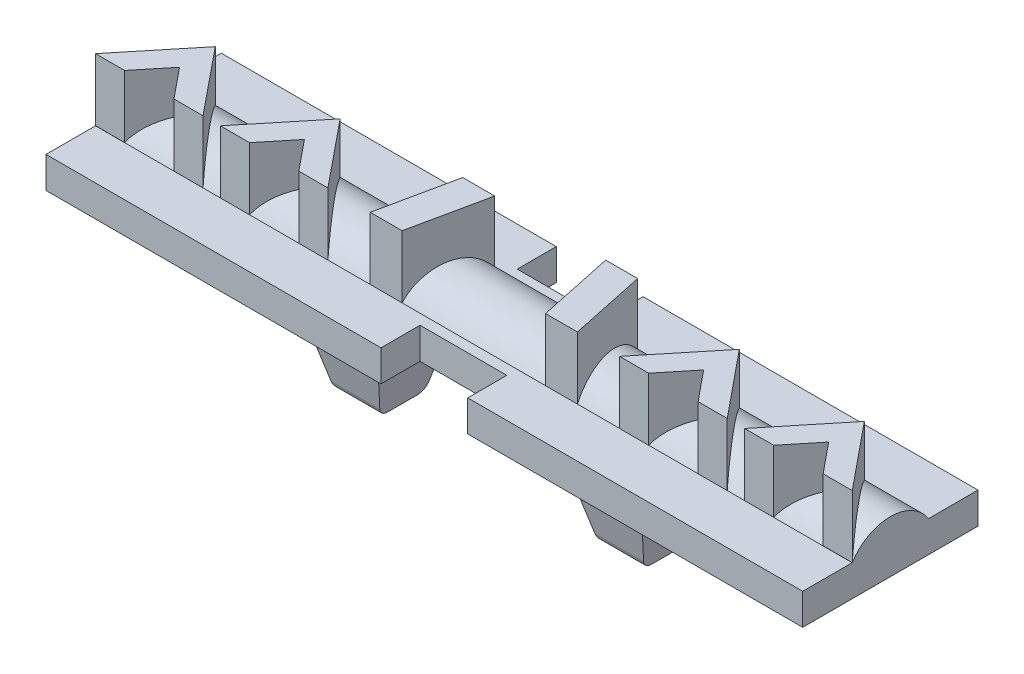
from build123d import *

# Parameters (mm, degrees)
EXTRUDE_1_DEPTH     = 109
EXTRUDE_2_DEPTH     = 18
SKETCH_3_W          = 25
SKETCH_3_H          = 11.25
CUT_EXTRUDE_1_DEPTH = 18
SKETCH_4_W          = 25
SKETCH_4_H          = 27
EXTRUDE_3_DEPTH     = 27
CUT_EXTRUDE_2_DEPTH = 122.166018853
CUT_EXTRUDE_3_DEPTH = 166.462013552
FILLET_1_R          = 3


# Read off the part's stored shape, not the designer's step: Бобышка-Вытянуть2
with BuildPart() as part:
    # Эскиз1 → Бобышка-Вытянуть1 (new, symmetric)
    with BuildSketch(Plane(origin=(0, 0, 0), x_dir=(0, 0, -1), z_dir=(1, 0, 0))):
        with BuildLine():
            Line((11, 0), (25.25, 0))
            Line((25.25, 0), (25.25, -9))
            Line((25.25, -9), (-25.25, -9))
            Line((-25.25, -9), (-25.25, 0))
            Line((-25.25, 0), (-11, 0))
            ThreePointArc((-11, 0), (0, 6), (11, 0))
        make_face()
    extrude(amount=EXTRUDE_1_DEPTH, both=True)

    # Бобышка-Вытянуть2 outline → Бобышка-Вытянуть2 (add)
    with BuildSketch(Plane(origin=(0, 0, 0), x_dir=(1, 0, 0), z_dir=(0, 1, 0))):
        Polygon((16, 11), (20.656976684, -11), (29.856406461, -11), (25.199429777, 11), align=None)
        Polygon((-29.856406461, -11), (-20.656976684, -11), (-16, 11), (-25.199429777, 11), align=None)
        Polygon((78.012123179, -10.999996132), (86.400679256, -10.994643711), (93.506557878, -2.272856192), (100.623560797, -10.985568626), (109.012116871, -10.980216204), (93.499996845, 8.009889964), align=None)
        Polygon((64.623554487, -11.008538874), (73.012110561, -11.003186452), (57.499990534, 7.986919716), (42.012116871, -11.02296638), (50.400672946, -11.017613959), (57.506551567, -2.29582644), align=None)
        Polygon((-109.012116871, -10.980216204), (-100.623560797, -10.985568626), (-93.506557878, -2.272856192), (-86.400679256, -10.994643711), (-78.012123179, -10.999996132), (-93.499996845, 8.009889964), align=None)
        Polygon((-73.012110561, -11.003186452), (-64.623554487, -11.008538874), (-57.506551567, -2.29582644), (-50.400672946, -11.017613959), (-42.012116871, -11.02296638), (-57.499990534, 7.986919716), align=None)
    extrude(amount=EXTRUDE_2_DEPTH)

    # Эскиз3 → Вырез-Вытянуть1 (cut)
    with BuildSketch(Plane(origin=(0, 0, 0), x_dir=(1, 0, 0), z_dir=(0, 1, 0))):
        with Locations((0, 19.625)):
            Rectangle(SKETCH_3_W, SKETCH_3_H)
        with Locations((0, -19.625)):
            Rectangle(SKETCH_3_W, SKETCH_3_H)
    extrude(amount=-CUT_EXTRUDE_1_DEPTH, mode=Mode.SUBTRACT)

    # Эскиз4 → Бобышка-Вытянуть3 (add)
    with BuildSketch(Plane.XZ.offset(9)):
        with Locations((38, 0)):
            Rectangle(SKETCH_4_W, SKETCH_4_H)
        with Locations((-38, 0)):
            Rectangle(SKETCH_4_W, SKETCH_4_H)
    extrude(amount=EXTRUDE_3_DEPTH)

    # Эскиз6 → Вырез-Вытянуть2 (cut, through all)
    with BuildSketch(Plane.XY.offset(13.5)):
        Polygon((-50.5, -9), (-50.5, -36), (-44.5, -36), align=None)
        Polygon((-25.5, -36), (-31.5, -36), (-25.5, -9), align=None)
        Polygon((25.5, -9), (25.5, -36), (31.5, -36), align=None)
        Polygon((50.5, -36), (44.5, -36), (50.5, -9), align=None)
    extrude(amount=-CUT_EXTRUDE_2_DEPTH, mode=Mode.SUBTRACT)

    # Эскиз5 → Вырез-Вытянуть3 (cut, through all)
    with BuildSketch(Plane.ZY.offset(50.5)):
        Polygon((-13.5, -9), (-13.5, -36), (-6.5, -36), align=None)
        Polygon((13.5, -36), (6.5, -36), (13.5, -9), align=None)
    extrude(amount=-CUT_EXTRUDE_3_DEPTH, mode=Mode.SUBTRACT)

    # Скругление1
    fillet_1_edges = [part.edges().sort_by_distance(p)[0] for p in [
        (-38, -36, -6.5),
        (38, -36, -6.5),
        (-38, -36, 6.5),
        (38, -36, 6.5),
    ]]
    fillet(fillet_1_edges, radius=FILLET_1_R)


solid = part.part
